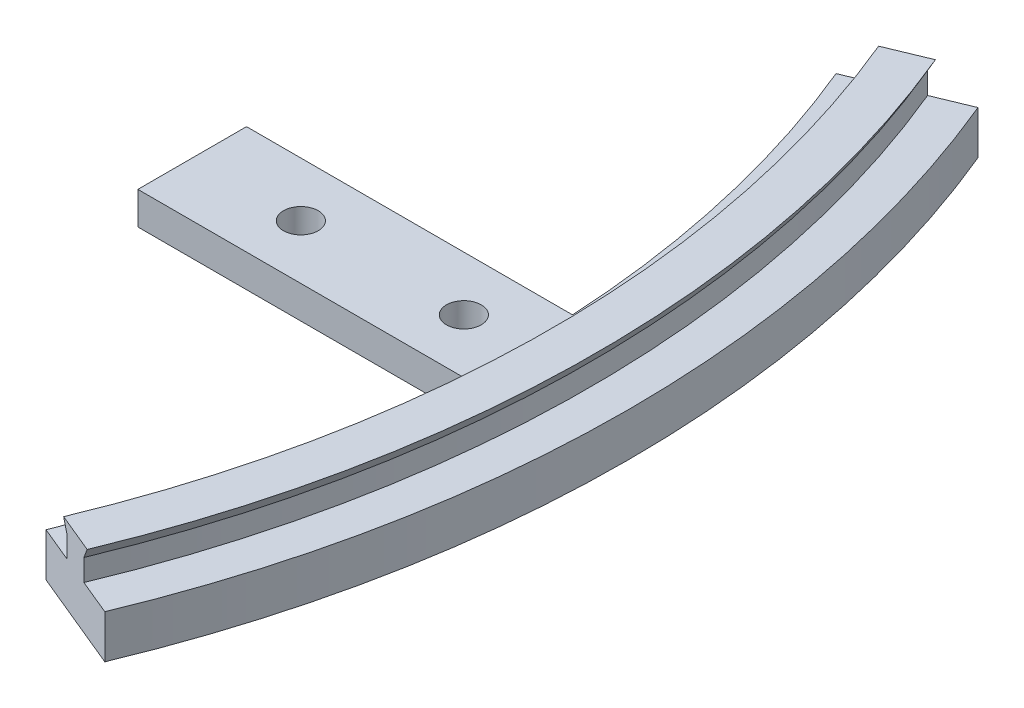
from build123d import *

# Parameters (mm, degrees)
REVOLVE1_ANGLE      = 45
BOSS_EXTRUDE1_START = 3
BOSS_EXTRUDE1_DEPTH = 3
SKETCH3_W           = 30.120603761
SKETCH3_H           = 2.9
BOSS_EXTRUDE2_DEPTH = 1
SKETCH4_R           = 1.6
CUT_EXTRUDE1_DEPTH  = 113.496994932


with BuildPart() as part:
    # Sketch1 → Revolve1 (revolve, symmetric)
    with BuildSketch(Plane.XY) as revolve1_sk:
        Polygon((105, 0), (105, 4), (101.45, 4), (101.45, 6), (102, 7), (98, 7), (98.55, 6), (98.55, 4), (95, 4), (95, 0), align=None)
    revolve(axis=Axis((0, -0.284703924, 0), (0, 1, 0)), revolution_arc=REVOLVE1_ANGLE / 2)
    revolve(revolve1_sk.sketch, axis=Axis((0, -0.284703924, 0), (0, -1, 0)), revolution_arc=REVOLVE1_ANGLE / 2)

    # Sketch2 → Boss-Extrude1 (add)
    with BuildSketch(Plane(origin=(0, 4, 0), x_dir=(-1, 0, 0), z_dir=(0, -1, 0)).offset(BOSS_EXTRUDE1_START)):
        with BuildLine():
            Line((-64.868329805, -5), (-64.868329805, 5))
            Line((-64.868329805, 5), (-94.868329805, 5))
            ThreePointArc((-94.868329805, 5), (-95, 0), (-94.868329805, -5))
            Line((-94.868329805, -5), (-64.868329805, -5))
        make_face()
    extrude(amount=-BOSS_EXTRUDE1_DEPTH)


with BuildPart() as body_2:
    # Sketch3 → Boss-Extrude2 (new body)
    with BuildSketch(Plane(origin=(0, 1, 0), x_dir=(-1, 0, 0), z_dir=(0, -1, 0))):
        with Locations((-79.928631685, 0)):
            Rectangle(SKETCH3_W, SKETCH3_H)
    extrude(amount=BOSS_EXTRUDE2_DEPTH)


with BuildPart() as cut_extrude1_tool:
    # Sketch4 → Cut-Extrude1 (new, through all)
    with BuildSketch(Plane(origin=(0, 4, 0), x_dir=(1, 0, 0), z_dir=(0, 1, 0))):
        with Locations((74.868329805, 0)):
            Circle(SKETCH4_R)
        with Locations((89.868329805, 0)):
            Circle(SKETCH4_R)
    extrude(amount=-CUT_EXTRUDE1_DEPTH)


with BuildPart() as part_1:
    add(part.part)

    # Cut-Extrude1: cut by cut_extrude1_tool
    add(cut_extrude1_tool.part, mode=Mode.SUBTRACT)


with BuildPart() as body_2_1:
    add(body_2.part)

    # Cut-Extrude1: cut by cut_extrude1_tool
    add(cut_extrude1_tool.part, mode=Mode.SUBTRACT)


solid = Compound([part_1.part, body_2_1.part])
